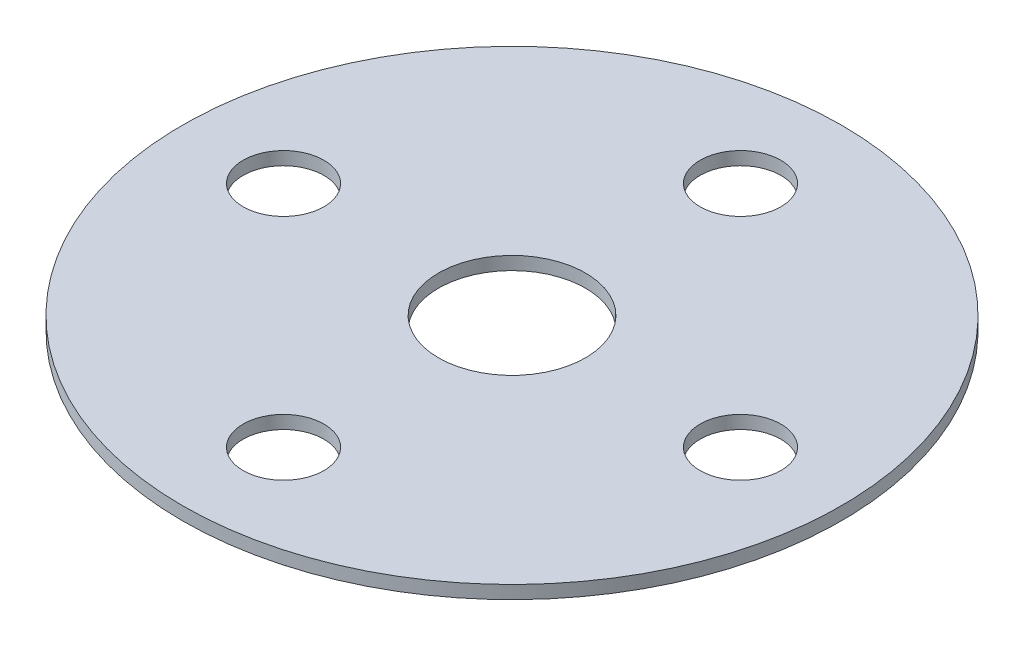
from build123d import *

# Parameters (mm, degrees)
SKETCH1_R           = 21.6364
SKETCH1_R_2         = 4.826
SKETCH1_R_3         = 2.65
BOSS_EXTRUDE1_DEPTH = 0.8636


with BuildPart() as part:
    # Sketch1 → Boss-Extrude1 (new body)
    with BuildSketch(Plane(origin=(0, 0, 0), x_dir=(1, 0, 0), z_dir=(0, 1, 0))):
        Circle(SKETCH1_R)
        Circle(SKETCH1_R_2, mode=Mode.SUBTRACT)
        with Locations((0, 15)):
            Circle(SKETCH1_R_3, mode=Mode.SUBTRACT)
        with Locations((15, 0)):
            Circle(SKETCH1_R_3, mode=Mode.SUBTRACT)
        with Locations((0, -15)):
            Circle(SKETCH1_R_3, mode=Mode.SUBTRACT)
        with Locations((-15, 0)):
            Circle(SKETCH1_R_3, mode=Mode.SUBTRACT)
    extrude(amount=BOSS_EXTRUDE1_DEPTH)


solid = part.part
